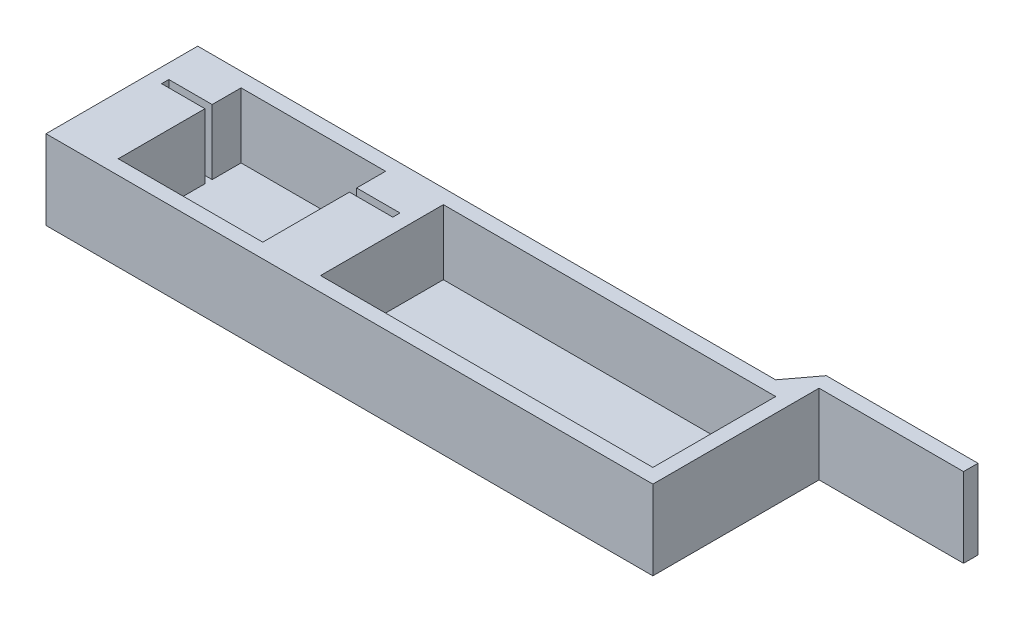
from build123d import *

# Parameters (mm, degrees)
BOSS_EXTRUDE1_DEPTH = 2
SKETCH1_4_W         = 46
SKETCH1_4_H         = 17
BOSS_EXTRUDE2_DEPTH = 11


with BuildPart() as part:
    # Sketch1 → Boss-Extrude1 (new body)
    with BuildSketch(Plane(origin=(0, 0, 0), x_dir=(1, 0, 0), z_dir=(0, 1, 0))):
        Polygon((-42, 10.5), (-42, -10.5), (42, -10.5), (42, 12.5), (62, 12.5), (62, 14.5), (41, 14.5), (38, 10.5), align=None)
    extrude(amount=BOSS_EXTRUDE1_DEPTH)

    # Sketch1<4> → Boss-Extrude2 (add)
    with BuildSketch(Plane(origin=(0, 0, 0), x_dir=(1, 0, 0), z_dir=(0, 1, 0))):
        Polygon((-42, 10.5), (-42, -10.5), (42, -10.5), (42, 12.5), (62, 12.5), (62, 14.5), (41, 14.5), (38, 10.5), align=None)
        Polygon((-14, 3.5), (-14, -8.5), (-34, -8.5), (-34, 3.5), (-40, 3.5), (-40, 4.5), (-34, 4.5), (-34, 8.5), (-14, 8.5), (-14, 4.5), (-8, 4.5), (-8, 3.5), align=None, mode=Mode.SUBTRACT)
        with Locations((17, 0)):
            Rectangle(SKETCH1_4_W, SKETCH1_4_H, mode=Mode.SUBTRACT)
    extrude(amount=BOSS_EXTRUDE2_DEPTH)


solid = part.part
